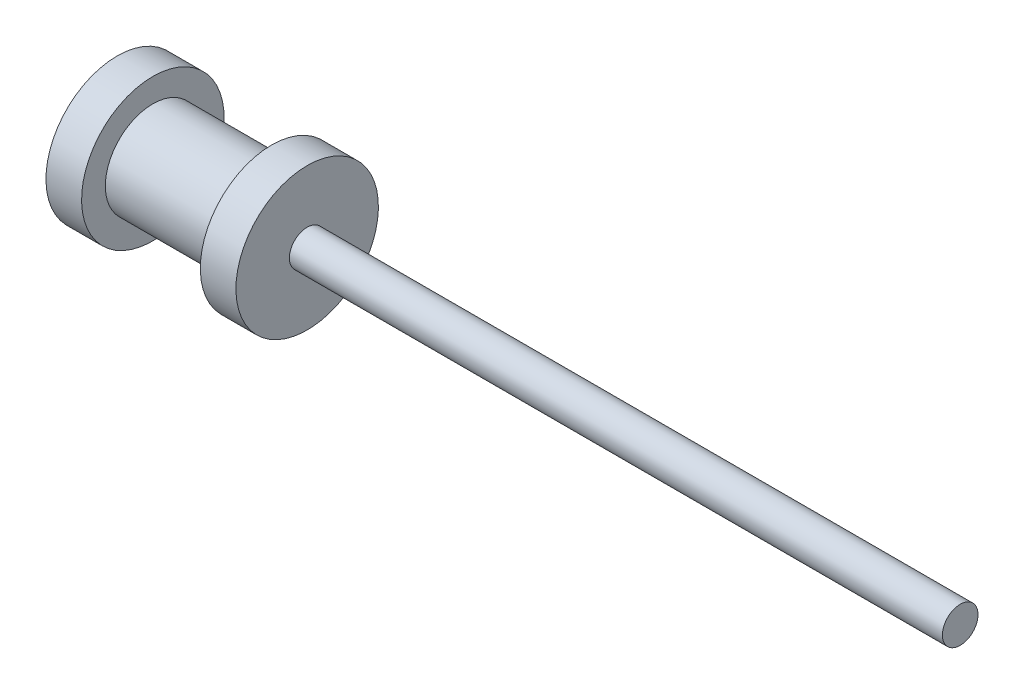
from build123d import *


with BuildPart() as part:
    # Sketch1 → Revolve1 (revolve)
    with BuildSketch(Plane.XY):
        Polygon((0, 0), (0, -6), (3, -6), (3, -4), (13, -4), (13, -6), (16, -6), (16, -1.5), (71, -1.5), (71, 0), align=None)
    revolve(axis=Axis((71, 0, 0), (-1, 0, 0)))


solid = part.part
